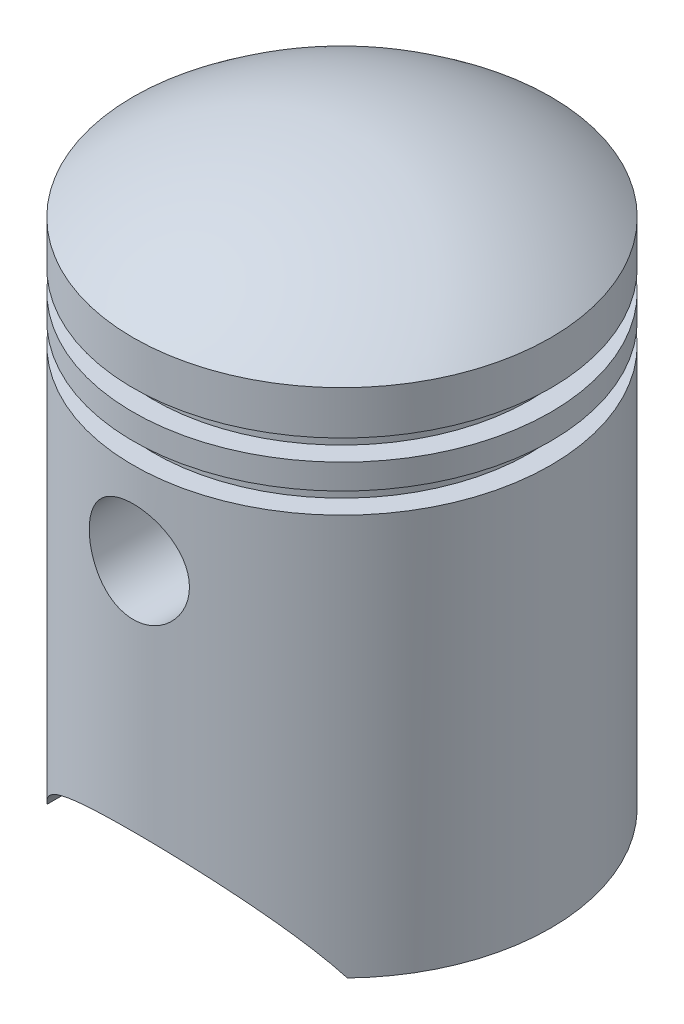
from build123d import *

# Parameters (mm, degrees)
SZKIC2_W                         = 2.5
SZKIC2_H                         = 2.5
SZYK_LINIOWY1_COUNT              = 2
SZYK_LINIOWY1_PITCH              = 5.5
WYTNIJ_WYCI_GNI_CIE3_DEPTH       = 79.421935707
WYTNIJ_WYCI_GNI_CIE3_DEPTH_BACK  = 79.421935707
WYTNIJ_WYCI_GNI_CIE4_DEPTH       = 79.421935771
WYTNIJ_WYCI_GNI_CIE4_DEPTH_BACK  = 79.421935771
SZKIC4_R                         = 6
DODANIE_WYCI_GNI_CIE2_REACH      = 90.422
DODANIE_WYCI_GNI_CIE2_END_RADIUS = 23
DODANIE_WYCI_GNI_CIE2_START      = 10
SZKIC5_R                         = 7.5
SZKIC5_R_2                       = 6


# Read off the part's stored shape, not the designer's step: Skorupa3
with BuildPart() as part:
    # Szkic1 → Obrót1 (revolve)
    with BuildSketch(Plane.XY, mode=Mode.PRIVATE) as obr_t1_sk:
        with BuildLine():
            Line((0, 0), (25, 0))
            Line((25, 0), (25, 61.224989992))
            ThreePointArc((25, 61.224989992), (13.247648854, 67.742546282), (0, 70))
            Line((0, 70), (0, 0))
        make_face()
    revolve(obr_t1_sk.sketch.rotate(Axis((0, 70, 0), (0, -1, 0)), 180), axis=Axis((0, 70, 0), (0, -1, 0)))

    # Szkic2 → Wycięcie-obrót1 (revolve, cut)
    with BuildSketch(Plane.XY):
        with Locations((23.75, 49.25)):
            Rectangle(SZKIC2_W, SZKIC2_H)
    wyci_cie_obr_t1 = revolve(axis=Axis((0, 70, 0), (0, 1, 0)), mode=Mode.SUBTRACT)

    # Szyk liniowy1: Wycięcie-obrót1 ×2
    with Locations(*[(0, i * SZYK_LINIOWY1_PITCH, 0) for i in range(1, SZYK_LINIOWY1_COUNT)]):
        add(wyci_cie_obr_t1, mode=Mode.SUBTRACT)

    # Skorupa3 outline → Skorupa3 (revolve, cut)
    with BuildSketch(Plane.XY):
        with BuildLine():
            Line((23, 0), (23, 46))
            Line((23, 46), (20.5, 46))
            Line((20.5, 46), (20.5, 58))
            Line((20.5, 58), (23, 58))
            Line((23, 58), (23.00000001, 60.248966917))
            ThreePointArc((23.00000001, 60.248966917), (12.135469854, 66.010142619), (0, 68))
            Line((0, 68), (0, 0))
            Line((0, 0), (23, 0))
        make_face()
    revolve(axis=Axis((0, 0, 0), (0, 1, 0)), mode=Mode.SUBTRACT)

    # Szkic3 → Wytnij-wyciągnięcie3 (cut, two sides: drawn at the far end of the back side and taken through both)
    with BuildSketch(Plane.XY.offset(-WYTNIJ_WYCI_GNI_CIE3_DEPTH_BACK)):
        with BuildLine():
            Line((110.085446515, -147.994467613), (18, 0))
            ThreePointArc((18, 0), (0, 10), (-18, 0))
            Line((-18, 0), (-110.085446515, -147.994467613))
            Line((-110.085446515, -147.994467613), (-110.085446515, -496.603657989))
            Line((-110.085446515, -496.603657989), (110.085446515, -496.603657989))
            Line((110.085446515, -496.603657989), (110.085446515, -147.994467613))
        make_face()
    extrude(amount=WYTNIJ_WYCI_GNI_CIE3_DEPTH + WYTNIJ_WYCI_GNI_CIE3_DEPTH_BACK, mode=Mode.SUBTRACT)

    # Szkic4 → Wytnij-wyciągnięcie4 (cut, two sides: drawn at the far end of the back side and taken through both)
    with BuildSketch(Plane.XY.offset(-WYTNIJ_WYCI_GNI_CIE4_DEPTH_BACK)):
        with Locations((0, 38)):
            Circle(SZKIC4_R)
    extrude(amount=WYTNIJ_WYCI_GNI_CIE4_DEPTH + WYTNIJ_WYCI_GNI_CIE4_DEPTH_BACK, mode=Mode.SUBTRACT)

    # Dodanie-wyciągnięcie2: up to this cylinder (the profile starts inside it)
    dodanie_wyci_gni_cie2_end = Plane(origin=(0, 38, 0), z_dir=(0, 1, 0)) * Cylinder(DODANIE_WYCI_GNI_CIE2_END_RADIUS, 227.844, mode=Mode.PRIVATE)
    # Szkic5 → Dodanie-wyciągnięcie2 (add, up to the surface)
    with BuildSketch(Plane.XY.offset(DODANIE_WYCI_GNI_CIE2_START), mode=Mode.PRIVATE) as dodanie_wyci_gni_cie2_sk1:
        with Locations(Location((0, 38, 0), (0, 0, 180))):
            Circle(SZKIC5_R)
        with Locations((0, 38)):
            Circle(SZKIC5_R_2, mode=Mode.SUBTRACT)
    dodanie_wyci_gni_cie2_tool1 = extrude(dodanie_wyci_gni_cie2_sk1.sketch, amount=DODANIE_WYCI_GNI_CIE2_REACH, mode=Mode.PRIVATE) & dodanie_wyci_gni_cie2_end
    dodanie_wyci_gni_cie2 = dodanie_wyci_gni_cie2_tool1.solids().sort_by_distance((7.287868, 38, 10))[0]
    add(dodanie_wyci_gni_cie2)

    # Lustro1: Dodanie-wyciągnięcie2 across plane
    add(dodanie_wyci_gni_cie2.mirror(Plane.XY))


solid = part.part
